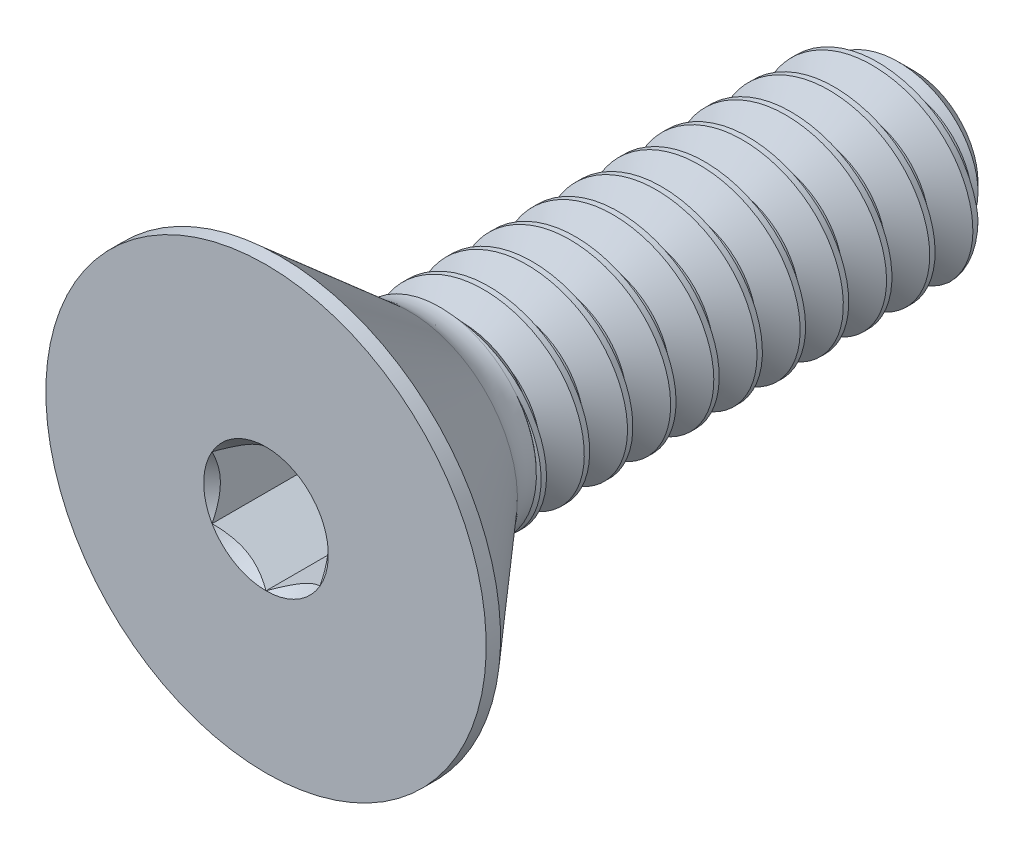
from build123d import *

# Parameters (mm, degrees)
SKETCH1_W          = 9.525
SKETCH1_H          = 1.4224
CHAMFER1_SIZE      = 0.47625
CUT_SWEEP1_PITCH   = 0.635
CUT_EXTRUDE2_DEPTH = 1.47574


with BuildPart() as part:
    # Sketch1 → Revolve1 (revolve)
    with BuildSketch(Plane(origin=(0, 0, 0), x_dir=(0, 0, -1), z_dir=(1, 0, 0))):
        with Locations((4.7625, 0.7112)):
            Rectangle(SKETCH1_W, SKETCH1_H)
    revolve(axis=Axis((0, 0, -9.525), (0, 0, 1)))

    # Chamfer1
    chamfer1_edges = [part.edges().sort_by_distance(p)[0] for p in [
        (0, -1.4224, -9.525),
    ]]
    chamfer(chamfer1_edges, length=CHAMFER1_SIZE)

    # Cut-Sweep1: the profile of Sketch2 profile screwed along a right-hand helix of 15 turns, 6 arcs to a turn; built about Z, then put on its axis
    cut_sweep1_z = Axis((0, 0, 0), (0, 0, 1))
    cut_sweep1_corners = [(1.4227, 0, 0.000173205), (1.4227, 0, -0.555798205), (1.009955401, 0, -0.3175), (1.009955401, 0, -0.238125)]
    with BuildLine(mode=Mode.PRIVATE) as cut_sweep1_profile:
        Line(cut_sweep1_corners[0], cut_sweep1_corners[1])
        Line(cut_sweep1_corners[1], cut_sweep1_corners[2])
        Line(cut_sweep1_corners[2], cut_sweep1_corners[3])
        Line(cut_sweep1_corners[3], cut_sweep1_corners[0])
    cut_sweep1_cap = Face(cut_sweep1_profile.wire())
    cut_sweep1_turn_angles = [0, 30, 60, 90, 120, 150, 180, 210, 240, 270, 300, 330, 360]
    cut_sweep1_turn_weights = [1, 0.8660254037844387, 1, 0.8660254037844387, 1, 0.8660254037844387, 1, 0.8660254037844387, 1, 0.8660254037844387, 1, 0.8660254037844387, 1]
    cut_sweep1_turn_rails = [Edge.make_bspline([Vector(p[0], p[1], 0).rotate(cut_sweep1_z, cut_sweep1_turn_angles[k]) / cut_sweep1_turn_weights[k] + Vector(0, 0, p[2] + CUT_SWEEP1_PITCH * cut_sweep1_turn_angles[k] / 360) for k in range(13)], [0, 0, 0, 1, 1, 2, 2, 3, 3, 4, 4, 5, 5, 6, 6, 6], 2, cut_sweep1_turn_weights) for p in cut_sweep1_corners]
    cut_sweep1_turn_sides = [Face.make_surface_from_curves(cut_sweep1_turn_rails[p[0]], cut_sweep1_turn_rails[p[1]]) for p in [(0, 1), (1, 2), (2, 3), (3, 0)]]
    cut_sweep1 = Plane(origin=(0, 0, -9.525), x_dir=(0, 1, 0), z_dir=(0, 0, 1)) * Solid(Shell([*[p.moved(Location((0, 0, CUT_SWEEP1_PITCH * i))) for i in range(15) for p in cut_sweep1_turn_sides], cut_sweep1_cap, cut_sweep1_cap.rotate(cut_sweep1_z, 5400).moved(Location((0, 0, CUT_SWEEP1_PITCH * 5400 / 360)))]))
    add(cut_sweep1, mode=Mode.SUBTRACT)

    # Sketch7 → Revolve2 (revolve)
    with BuildSketch(Plane(origin=(0, 0, 0), x_dir=(0, 0, -1), z_dir=(1, 0, 0)), mode=Mode.PRIVATE) as revolve2_sk:
        with BuildLine():
            Line((0, 3.2385), (0.21082, 3.2385))
            Line((0.21082, 3.2385), (2.1082, 1.589132729))
            ThreePointArc((2.1082, 1.589132729), (2.316098376, 1.465446193), (2.554146942, 1.4224))
            Line((2.554146942, 1.4224), (2.554146942, 0))
            Line((2.554146942, 0), (0, 0))
            Line((0, 0), (0, 3.2385))
        make_face()
    revolve(revolve2_sk.sketch.rotate(Axis((0, 0, 0), (0, 0, -1)), 189.336081704), axis=Axis((0, 0, 0), (0, 0, -1)))

    # Boss-Extrude1 cone 1 section (through the dimple's axis) → Boss-Extrude1 (revolve)
    with BuildSketch(Plane(origin=(0, 0, -2.554146942), x_dir=(0, -1, 0), z_dir=(1, 0, 0))):
        Polygon((0, 0), (1.4224, 0), (0, 1.303389462), align=None)
    revolve(axis=Axis((0, 0, -2.554146942), (0, 0, -1)))

    # Sketch5 → Cut-Extrude2 (cut)
    with BuildSketch(Plane.XY):
        Polygon((0.79375, -0.458271776), (0.79375, 0.458271776), (0, 0.916543552), (-0.79375, 0.458271776), (-0.79375, -0.458271776), (0, -0.916543552), align=None)
    extrude(amount=-CUT_EXTRUDE2_DEPTH, mode=Mode.SUBTRACT)

    # Cut-Extrude3 cone 1 section (through the dimple's axis) → Cut-Extrude3 (revolve, cut)
    with BuildSketch(Plane(origin=(0, 0, 0), x_dir=(0, -1, 0), z_dir=(1, 0, 0))):
        Polygon((0, 0), (0.916543552, 0), (0, 0.916543552), align=None)
    revolve(axis=Axis((0, 0, 0), (0, 0, -1)), mode=Mode.SUBTRACT)


solid = part.part
